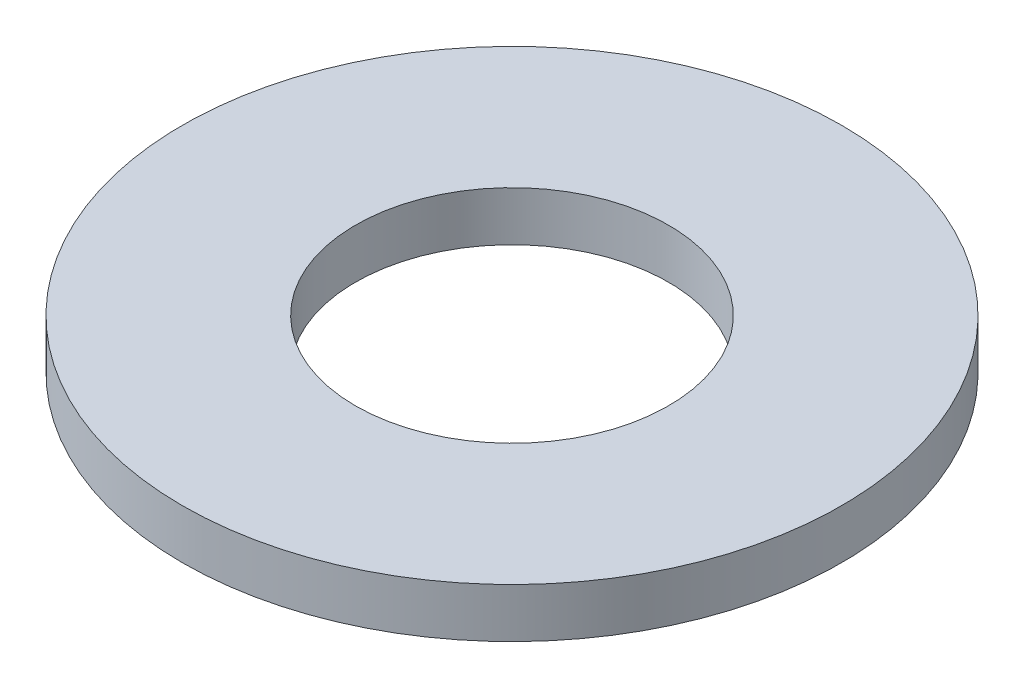
from build123d import *

# Parameters (mm, degrees)
SKETCH1_R           = 100
BOSS_EXTRUDE1_DEPTH = 15
SKETCH2_R           = 47.5
CUT_EXTRUDE1_DEPTH  = 143.214626533


with BuildPart() as part:
    # Sketch1 → Boss-Extrude1 (new body)
    with BuildSketch(Plane(origin=(0, 0, 0), x_dir=(1, 0, 0), z_dir=(0, 1, 0))):
        Circle(SKETCH1_R)
    extrude(amount=BOSS_EXTRUDE1_DEPTH)

    # Sketch2 → Cut-Extrude1 (cut, through all)
    with BuildSketch(Plane(origin=(0, 0, 0), x_dir=(1, 0, 0), z_dir=(0, 1, 0))):
        Circle(SKETCH2_R)
    extrude(amount=CUT_EXTRUDE1_DEPTH, mode=Mode.SUBTRACT)


solid = part.part
